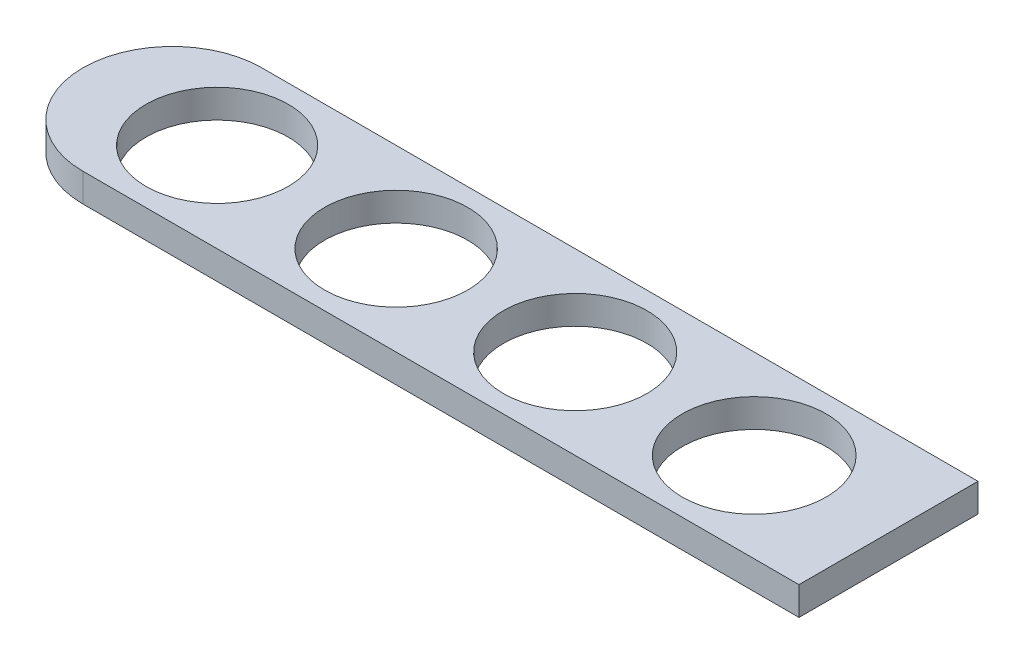
from build123d import *

# Parameters (mm, degrees)
SKETCH1_W           = 90
SKETCH1_H           = 20
SKETCH1_R           = 7.95
SKETCH1_R_2         = 8
SKETCH1_R_3         = 8.025
SKETCH1_R_4         = 8.05
BOSS_EXTRUDE1_DEPTH = 3.175
FILLET1_R           = 10


with BuildPart() as part:
    # Sketch1 → Boss-Extrude1 (new body)
    with BuildSketch(Plane(origin=(0, 0, 0), x_dir=(1, 0, 0), z_dir=(0, 1, 0))):
        Rectangle(SKETCH1_W, SKETCH1_H)
        with Locations(Location((-30, 0, 0), (0, 0, 270))):
            Circle(SKETCH1_R, mode=Mode.SUBTRACT)
        with Locations(Location((-10, 0, 0), (0, 0, 270))):
            Circle(SKETCH1_R_2, mode=Mode.SUBTRACT)
        with Locations(Location((10, 0, 0), (0, 0, 270))):
            Circle(SKETCH1_R_3, mode=Mode.SUBTRACT)
        with Locations(Location((30, 0, 0), (0, 0, 270))):
            Circle(SKETCH1_R_4, mode=Mode.SUBTRACT)
    extrude(amount=BOSS_EXTRUDE1_DEPTH)

    # Fillet1
    fillet1_edges = [part.edges().sort_by_distance(p)[0] for p in [
        (-45, 1.5875, -10),
        (-45, 1.5875, 10),
    ]]
    fillet(fillet1_edges, radius=FILLET1_R - 0.0001)  # a hair under: the kernel refuses the full size


solid = part.part
